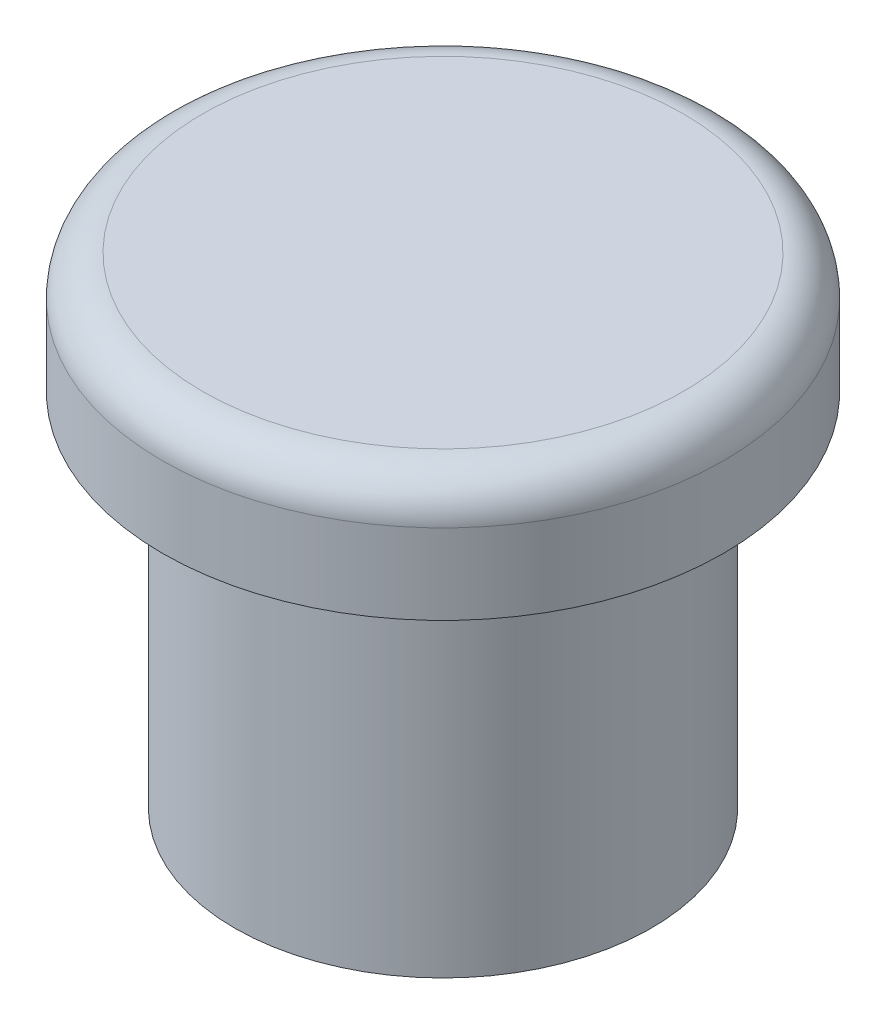
from build123d import *

# Parameters (mm, degrees)
SKETCH1_R           = 2.6
SKETCH1_R_2         = 1.95
BOSS_EXTRUDE1_DEPTH = 4.5
SKETCH2_R           = 3.5
BOSS_EXTRUDE2_DEPTH = 1.5
FILLET1_R           = 0.5


with BuildPart() as part:
    # Sketch1 → Boss-Extrude1 (new body)
    with BuildSketch(Plane(origin=(0, 0, 0), x_dir=(1, 0, 0), z_dir=(0, 1, 0))):
        Circle(SKETCH1_R)
        Circle(SKETCH1_R_2, mode=Mode.SUBTRACT)
    extrude(amount=BOSS_EXTRUDE1_DEPTH)

    # Sketch2 → Boss-Extrude2 (add)
    with BuildSketch(Plane(origin=(0, 4.5, 0), x_dir=(1, 0, 0), z_dir=(0, 1, 0))):
        Circle(SKETCH2_R)
    extrude(amount=BOSS_EXTRUDE2_DEPTH)

    # Fillet1
    fillet1_edges = [part.edges().sort_by_distance(p)[0] for p in [
        (-3.5, 6, 0),
    ]]
    fillet(fillet1_edges, radius=FILLET1_R)


solid = part.part
